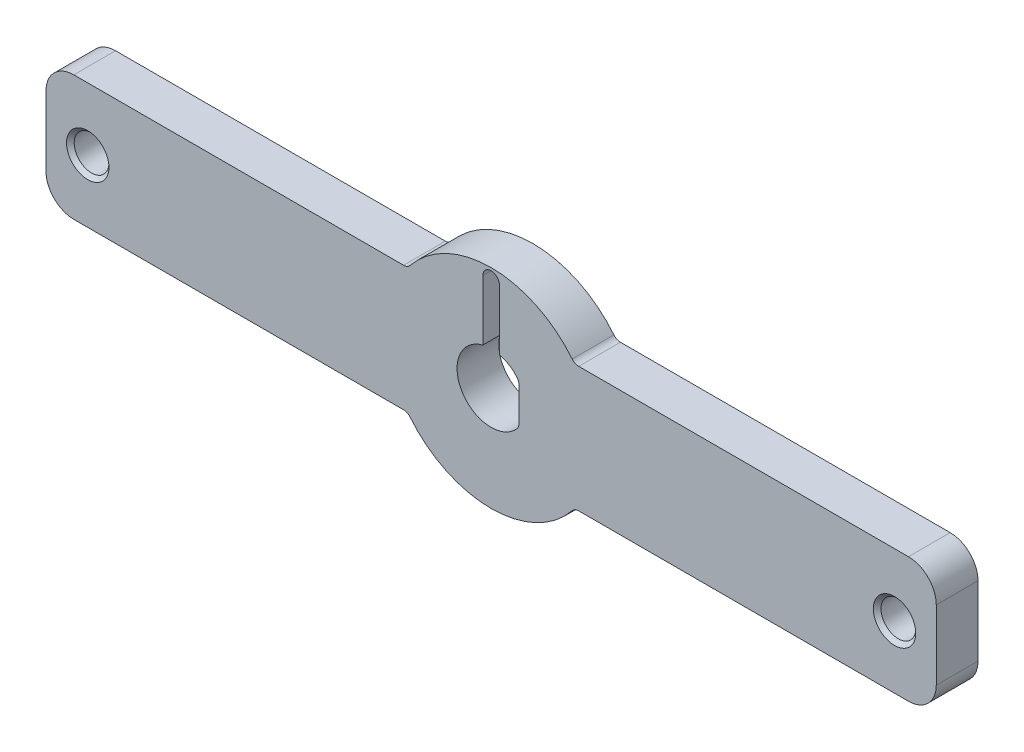
from build123d import *

# Parameters (mm, degrees)
EXTRUDE_1_DEPTH      = 3
M3X0_5_1_D           = 2.5
M3X0_5_1_CSINK_D     = 3.05
M3X0_5_1_CSINK_ANGLE = 90
FILLET_1_R           = 0.6


with BuildPart() as part:
    # 草图1 → 凸台-拉伸1 (new body)
    with BuildSketch(Plane.XY):
        with BuildLine():
            Line((6, 4.5), (30, 4.5))
            ThreePointArc((30, 4.5), (31.414213562, 3.914213562), (32, 2.5))
            Line((32, 2.5), (32, -2.5))
            ThreePointArc((32, -2.5), (31.414213562, -3.914213562), (30, -4.5))
            Line((30, -4.5), (6, -4.5))
            ThreePointArc((6, -4.5), (0, -7.5), (-6, -4.5))
            Line((-6, -4.5), (-30, -4.5))
            ThreePointArc((-30, -4.5), (-31.414213562, -3.914213562), (-32, -2.5))
            Line((-32, -2.5), (-32, 2.5))
            ThreePointArc((-32, 2.5), (-31.414213562, 3.914213562), (-30, 4.5))
            Line((-30, 4.5), (-6, 4.5))
            ThreePointArc((-6, 4.5), (-3.045393494, 6.853873246), (0.681818182, 7.468943966))
            ThreePointArc((0.681818182, 7.468943966), (3.6558625, 6.548638742), (6, 4.5))
        make_face()
        with BuildLine():
            Line((0.6, 7.275300681), (0.6, 2.375394704))
            ThreePointArc((0.6, 2.375394704), (1.385836512, 2.020385399), (2, 1.41509717))
            Line((2, 1.41509717), (2, -1.41509717))
            ThreePointArc((2, -1.41509717), (-2.020385399, -1.385836512), (-0.6, 2.375394704))
            Line((-0.6, 2.375394704), (-0.6, 7.275300681))
            ThreePointArc((-0.6, 7.275300681), (0, 7.3), (0.6, 7.275300681))
        make_face(mode=Mode.SUBTRACT)
    extrude(amount=EXTRUDE_1_DEPTH)

    # M3x0.5 螺纹孔1 (through all)
    with Locations(Plane.XY.offset(3)):
        with Locations((-29, 0), (29, 0)):
            CounterSinkHole(M3X0_5_1_D / 2, M3X0_5_1_CSINK_D / 2, counter_sink_angle=M3X0_5_1_CSINK_ANGLE)

    # 圆角1
    fillet_1_edges = [part.edges().sort_by_distance(p)[0] for p in [
        (0.6, 7.275300681, 1.5),
        (-0.6, 7.275300681, 1.5),
        (2, -1.41509717, 1.5),
        (2, 1.41509717, 1.5),
        (-6, -4.5, 1.5),
        (6, -4.5, 1.5),
        (6, 4.5, 1.5),
        (-6, 4.5, 1.5),
    ]]
    fillet(fillet_1_edges, radius=FILLET_1_R - 0.0001)  # a hair under: the kernel refuses the full size


solid = part.part
